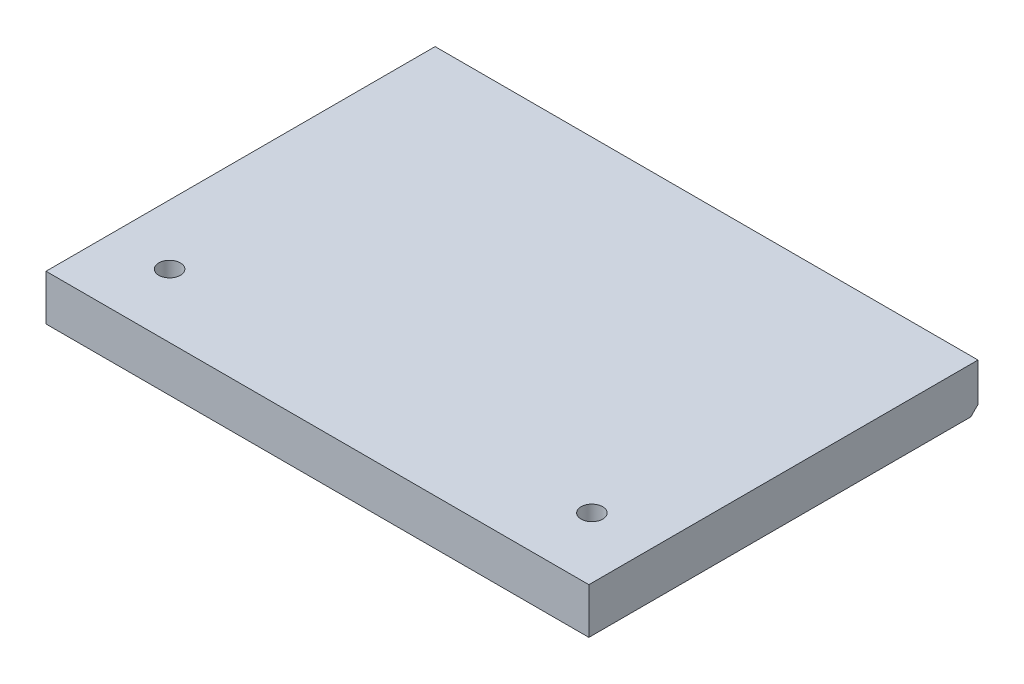
from build123d import *

# Parameters (mm, degrees)
SKETCH1_W                      = 172.4
SKETCH1_H                      = 192.4
BOSS_EXTRUDE1_DEPTH            = 6.35
CUT_EXTRUDE1_REACH             = 131.326
SKETCH2_W                      = 41
SKETCH2_H                      = 41
CBORE_FOR_M4_SHCS1_D           = 4.5
CBORE_FOR_M4_SHCS1_CBORE_D     = 8
CBORE_FOR_M4_SHCS1_CBORE_DEPTH = 4
CUT_EXTRUDE3_REACH             = 131.326
SKETCH5_R                      = 1.2
SKETCH6_R                      = 1.4
CUT_EXTRUDE4_DEPTH             = 4
CUT_EXTRUDE5_REACH             = 131.326
SKETCH7_R                      = 1.35
SKETCH8_R                      = 1.5
CUT_EXTRUDE6_DEPTH             = 5
SKETCH9_W                      = 3
SKETCH9_H                      = 192.4
EXTRUDE_THIN1_DEPTH            = 3
CHAMFER1_SIZE                  = 3
CHAMFER2_SIZE                  = 1
CUT_EXTRUDE8_DEPTH             = 302.265202936
CUT_EXTRUDE8_DEPTH_BACK        = 302.265202936
SKETCH11_W                     = 285.28996188
SKETCH11_H                     = 259.000443209
SKETCH11_W_2                   = 75.460655446
SKETCH11_H_2                   = 65.723796679


with BuildPart() as part:
    # Sketch1 → Boss-Extrude1 (new body)
    with BuildSketch(Plane(origin=(0, 0, 0), x_dir=(1, 0, 0), z_dir=(0, 1, 0))):
        Rectangle(SKETCH1_W, SKETCH1_H)
    extrude(amount=BOSS_EXTRUDE1_DEPTH)

    # Sketch2 → Cut-Extrude1 (cut, up to next)
    with BuildSketch(Plane(origin=(0, 6.35, 0), x_dir=(1, 0, 0), z_dir=(0, 1, 0)), mode=Mode.PRIVATE) as cut_extrude1_sk1:
        with Locations((-65.7, 75.7)):
            Rectangle(SKETCH2_W, SKETCH2_H)
    cut_extrude1_tool1 = extrude(cut_extrude1_sk1.sketch, amount=-CUT_EXTRUDE1_REACH, mode=Mode.PRIVATE) & part.part
    add(cut_extrude1_tool1.solids().sort_by_distance((-65.7, 6.35, -75.7))[0], mode=Mode.SUBTRACT)

    # CBORE for M4 SHCS1 (through all)
    with Locations(Plane(origin=(0, 6.35, 0), x_dir=(1, 0, 0), z_dir=(0, 1, 0))):
        with Locations((66.2, 76.2), (-66.2, 34.39549116), (-66.2, -56.2), (-26.2, 76.2)):
            CounterBoreHole(CBORE_FOR_M4_SHCS1_D / 2, CBORE_FOR_M4_SHCS1_CBORE_D / 2, CBORE_FOR_M4_SHCS1_CBORE_DEPTH)

    # Sketch5 → Cut-Extrude3 (cut, up to next)
    with BuildSketch(Plane(origin=(0, 6.35, 0), x_dir=(1, 0, 0), z_dir=(0, 1, 0)), mode=Mode.PRIVATE) as cut_extrude3_sk1:
        with Locations(Location((-76.36, -87.31, 0), (0, 0, 270))):
            Circle(SKETCH5_R)
    cut_extrude3_tool1 = extrude(cut_extrude3_sk1.sketch, amount=-CUT_EXTRUDE3_REACH, mode=Mode.PRIVATE) & part.part
    # Sketch5 → Cut-Extrude3 (cut, up to next)
    with BuildSketch(Plane(origin=(0, 6.35, 0), x_dir=(1, 0, 0), z_dir=(0, 1, 0)), mode=Mode.PRIVATE) as cut_extrude3_sk2:
        with Locations(Location((-56.04, -87.31, 0), (0, 0, 270))):
            Circle(SKETCH5_R)
    cut_extrude3_tool2 = extrude(cut_extrude3_sk2.sketch, amount=-CUT_EXTRUDE3_REACH, mode=Mode.PRIVATE) & part.part
    add(cut_extrude3_tool1.solids().sort_by_distance((-76.36, 6.35, 87.31))[0], mode=Mode.SUBTRACT)
    add(cut_extrude3_tool2.solids().sort_by_distance((-56.04, 6.35, 87.31))[0], mode=Mode.SUBTRACT)

    # Sketch6 → Cut-Extrude4 (cut)
    with BuildSketch(Plane(origin=(0, 6.35, 0), x_dir=(1, 0, 0), z_dir=(0, 1, 0))):
        with Locations(Location((-76.36, -87.31, 0), (0, 0, 270))):
            Circle(SKETCH6_R)
        with Locations(Location((-56.04, -87.31, 0), (0, 0, 270))):
            Circle(SKETCH6_R)
    extrude(amount=-CUT_EXTRUDE4_DEPTH, mode=Mode.SUBTRACT)

    # Sketch7 → Cut-Extrude5 (cut, up to next)
    with BuildSketch(Plane(origin=(0, 6.35, 0), x_dir=(1, 0, 0), z_dir=(0, 1, 0)), mode=Mode.PRIVATE) as cut_extrude5_sk1:
        with Locations(Location((-35.24, -50.96, 0), (0, 0, 270))):
            Circle(SKETCH7_R)
    cut_extrude5_tool1 = extrude(cut_extrude5_sk1.sketch, amount=-CUT_EXTRUDE5_REACH, mode=Mode.PRIVATE) & part.part
    # Sketch7 → Cut-Extrude5 (cut, up to next)
    with BuildSketch(Plane(origin=(0, 6.35, 0), x_dir=(1, 0, 0), z_dir=(0, 1, 0)), mode=Mode.PRIVATE) as cut_extrude5_sk2:
        with Locations(Location((23.46, -50.96, 0), (0, 0, 270))):
            Circle(SKETCH7_R)
    cut_extrude5_tool2 = extrude(cut_extrude5_sk2.sketch, amount=-CUT_EXTRUDE5_REACH, mode=Mode.PRIVATE) & part.part
    add(cut_extrude5_tool1.solids().sort_by_distance((-35.24, 6.35, 50.96))[0], mode=Mode.SUBTRACT)
    add(cut_extrude5_tool2.solids().sort_by_distance((23.46, 6.35, 50.96))[0], mode=Mode.SUBTRACT)

    # Sketch8 → Cut-Extrude6 (cut)
    with BuildSketch(Plane(origin=(0, 6.35, 0), x_dir=(1, 0, 0), z_dir=(0, 1, 0))):
        with Locations(Location((-35.24, -50.96, 0), (0, 0, 270))):
            Circle(SKETCH8_R)
        with Locations(Location((23.46, -50.96, 0), (0, 0, 270))):
            Circle(SKETCH8_R)
    extrude(amount=-CUT_EXTRUDE6_DEPTH, mode=Mode.SUBTRACT)

    # Sketch9 → Extrude-Thin1 (add)
    with BuildSketch(Plane(origin=(0, 6.35, 0), x_dir=(1, 0, 0), z_dir=(0, 1, 0))):
        with Locations((78.7, 0)):
            Rectangle(SKETCH9_W, SKETCH9_H)
    extrude(amount=EXTRUDE_THIN1_DEPTH)

    # Chamfer1
    chamfer1_edges = [part.edges().sort_by_distance(p)[0] for p in [
        (77.2, 6.35, 0),
        (80.2, 6.35, 0),
    ]]
    chamfer(chamfer1_edges, length=CHAMFER1_SIZE - 0.0001)  # a hair under: the kernel refuses the full size

    # Chamfer2
    chamfer2_edges = [part.edges().sort_by_distance(p)[0] for p in [
        (0, 0, 96.2),
        (86.2, 0, 0),
    ]]
    chamfer(chamfer2_edges, length=CHAMFER2_SIZE)


with BuildPart() as body_2:
    # Mirror1: mirrored copy
    add(part.part.mirror(Plane(origin=(1.506427127, 3.750129783, 96.2), x_dir=(1, 0, 0), z_dir=(0, 0, 1))))

    # Sketch11 → Cut-Extrude8 (cut, two sides: drawn at the far end of the back side and taken through both)
    with BuildSketch(Plane(origin=(0, 6.35, 0), x_dir=(1, 0, 0), z_dir=(0, 1, 0)).offset(-CUT_EXTRUDE8_DEPTH_BACK)):
        with Locations((10.467123175, -184.853934456)):
            Rectangle(SKETCH11_W, SKETCH11_H)
        with Locations((-5.84211526, -117.426187493)):
            Rectangle(SKETCH11_W_2, SKETCH11_H_2, mode=Mode.SUBTRACT)
    extrude(amount=CUT_EXTRUDE8_DEPTH + CUT_EXTRUDE8_DEPTH_BACK, mode=Mode.SUBTRACT)


solid = body_2.part
